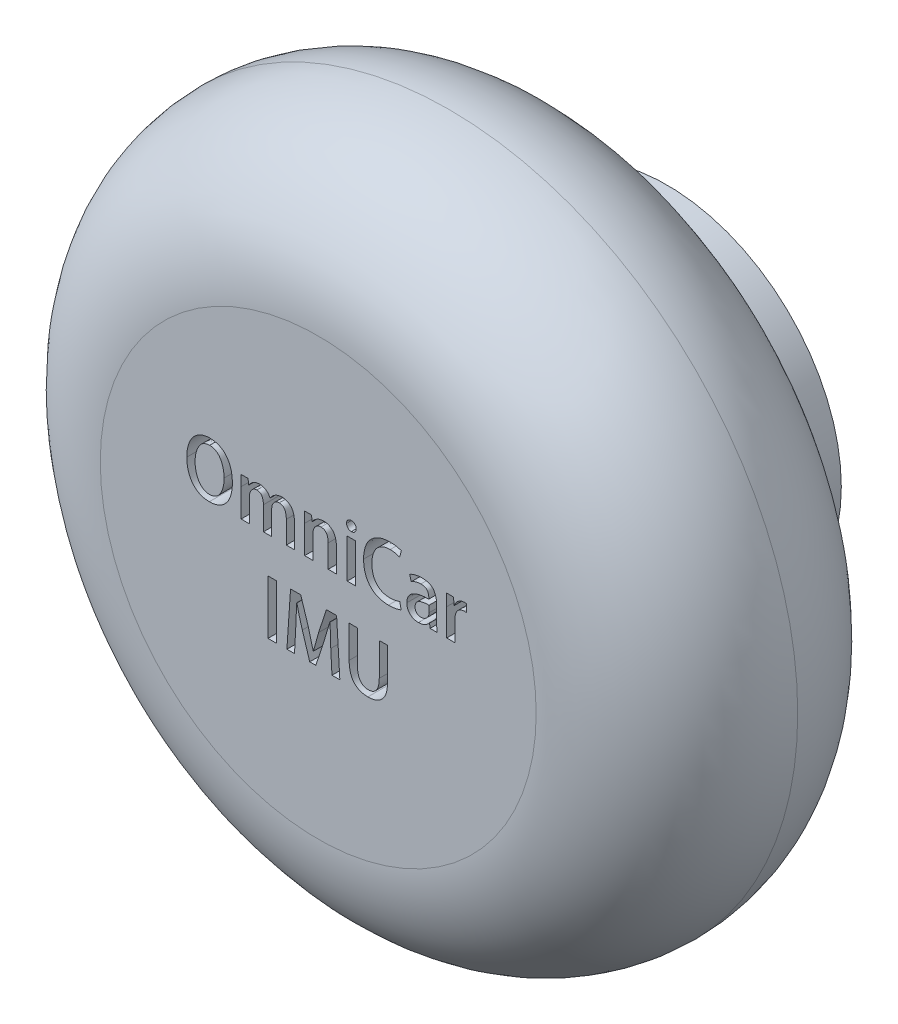
from build123d import *

# Parameters (mm, degrees)
SKETCH_1_R          = 400
EXTRUDE_1_DEPTH     = 300
FILLET_1_R          = 150
SKETCH_2_W          = 9.526879765
SKETCH_2_H          = 44.765538385
SKETCH_2_H_2        = 62.088888889
CUT_EXTRUDE_1_DEPTH = 100
SKETCH_3_R          = 200
EXTRUDE_2_DEPTH     = 100


with BuildPart() as part:
    # 草图1 → 凸台-拉伸1 (new body)
    with BuildSketch(Plane.XY):
        Circle(SKETCH_1_R)
    extrude(amount=EXTRUDE_1_DEPTH)

    # 圆角1
    fillet_1_edges = [part.edges().sort_by_distance(p)[0] for p in [
        (-400, 0, 0),
        (-400, 0, 300),
    ]]
    fillet(fillet_1_edges, radius=FILLET_1_R - 0.0001)  # a hair under: the kernel refuses the full size

    # 草图2 → 切除-拉伸1 (cut)
    # profile 1 of 11: a face of its own
    with BuildSketch(Plane.XY.offset(300)):
        with BuildLine():
            add(Edge.make_bspline(
                [(-124.135271202, 86.407969212), (-125.131940367, 86.369114214), (-127.078244568, 86.293237836), (-129.913756761, 85.848266434), (-132.589069085, 85.160822731), (-135.10879045, 84.210171328), (-137.458937755, 82.976952123), (-139.653479211, 81.492241707), (-141.687092971, 79.742227084), (-143.53381844, 77.730284885), (-145.205118624, 75.496446141), (-146.66353491, 73.046313342), (-147.890900987, 70.392084577), (-148.922682207, 67.544948436), (-149.706411494, 64.489774567), (-150.294088927, 61.239841905), (-150.65865484, 57.788434899), (-150.726577139, 55.419164729), (-150.76147075, 54.202003449)],
                knots=[0, 0, 0, 0, 1.017398794, 1.986785202, 2.923065462, 3.832757107, 4.72909869, 5.625929049, 6.53174102, 7.461145409, 8.40803719, 9.374715613, 10.365893456, 11.388720988, 12.4615384, 13.581250007, 14.757419533, 16, 16, 16, 16], degree=3))
            add(Edge.make_bspline(
                [(-150.76147075, 54.202003449), (-150.736323814, 53.031570469), (-150.687258416, 50.74788242), (-150.3169957, 47.426307436), (-149.795693414, 44.28387262), (-149.025296808, 41.336233438), (-148.074378789, 38.559832015), (-146.877069044, 35.987822784), (-145.50866399, 33.581582065), (-143.909722879, 31.394254), (-142.138603918, 29.41037415), (-140.186113215, 27.675379622), (-138.056030745, 26.209673482), (-135.758186491, 25.005117996), (-133.294266018, 24.052702907), (-130.662498083, 23.360292583), (-127.864899388, 22.936500047), (-125.944579883, 22.857666195), (-124.961491185, 22.817307979)],
                knots=[0, 0, 0, 0, 1.22750573, 2.395045433, 3.502533319, 4.566253198, 5.587370864, 6.576785445, 7.538036659, 8.486659168, 9.413382605, 10.323058447, 11.219792233, 12.119000186, 13.038585654, 13.984943243, 14.968411497, 16, 16, 16, 16], degree=3))
            add(Edge.make_bspline(
                [(-124.961491185, 22.817307979), (-124.009787453, 22.836894305), (-122.141634373, 22.875341411), (-119.411186782, 23.264653362), (-116.812166709, 23.876660582), (-114.362477195, 24.767962603), (-112.036351544, 25.883334311), (-109.86101678, 27.278662547), (-107.822255402, 28.924953361), (-105.911123334, 30.798502394), (-104.193828706, 32.9478818), (-102.679293981, 35.355484243), (-101.424258525, 38.039119168), (-100.361074655, 40.966514242), (-99.536971904, 44.157729177), (-98.934808307, 47.60624535), (-98.543870519, 51.311104882), (-98.471443142, 53.868587574), (-98.43409064, 55.18754155)],
                knots=[0, 0, 0, 0, 0.964919428, 1.894094917, 2.791917438, 3.669166524, 4.533326732, 5.403911337, 6.284393302, 7.187765246, 8.113478337, 9.068979773, 10.066339515, 11.113068972, 12.22455083, 13.40519489, 14.661797975, 16, 16, 16, 16], degree=3))
            add(Edge.make_bspline(
                [(-98.43409064, 55.18754155), (-98.453541788, 56.310705641), (-98.491576382, 58.506930252), (-98.81261086, 61.718863077), (-99.342209537, 64.763687204), (-100.052074772, 67.654612939), (-100.974519344, 70.382562479), (-102.122197596, 72.942972748), (-103.460511812, 75.345012204), (-104.992999837, 77.577547279), (-106.720197214, 79.604878833), (-108.665945962, 81.360384671), (-110.776049456, 82.885243508), (-113.095093893, 84.113650968), (-115.593529674, 85.096668651), (-118.278383087, 85.806801532), (-121.149785537, 86.255381308), (-123.12567671, 86.348457543), (-124.140209434, 86.396248073)],
                knots=[0, 0, 0, 0, 1.183096314, 2.313415522, 3.396550671, 4.436833047, 5.446633386, 6.42599101, 7.388863574, 8.339751712, 9.274678886, 10.187639936, 11.094331523, 12.010485338, 12.944704076, 13.917164331, 14.930556008, 16, 16, 16, 16], degree=3))
            Line((-124.140209434, 86.396248073), (-124.135271202, 86.407969212))
        make_face()
        with BuildLine():
            add(Edge.make_bspline(
                [(-124.463921394, 79.133747964), (-123.786721667, 79.079702319), (-122.46188383, 78.97397027), (-120.548744921, 78.542012603), (-118.766491147, 77.914349529), (-117.122370263, 77.05813819), (-115.622956379, 75.977936427), (-114.252847171, 74.689635464), (-113.024885678, 73.185299845), (-111.96244488, 71.481060632), (-111.023411283, 69.64973825), (-110.203386672, 67.730270974), (-109.4930598, 65.750932306), (-108.93707196, 63.696610451), (-108.481230525, 61.583679242), (-108.189412698, 59.398086649), (-107.989630543, 57.150619792), (-107.970604155, 55.629926737), (-107.960958947, 54.85902885)],
                knots=[0, 0, 0, 0, 0.9982897, 1.953001328, 2.875573597, 3.771039444, 4.669862355, 5.585593193, 6.529935263, 7.517851827, 8.534187404, 9.55473136, 10.586435127, 11.624837768, 12.683192089, 13.763643614, 14.866304802, 16, 16, 16, 16], degree=3))
            add(Edge.make_bspline(
                [(-107.960958947, 54.85902885), (-107.976227754, 54.013998046), (-108.006167155, 52.357043715), (-108.189397205, 49.922891926), (-108.522163337, 47.592692083), (-108.970816871, 45.359338777), (-109.576726426, 43.234582537), (-110.287232541, 41.202279603), (-111.14712359, 39.277924649), (-112.124659565, 37.463305561), (-113.220920665, 35.793456014), (-114.481232461, 34.342463905), (-115.84269875, 33.074010801), (-117.364752543, 32.056576449), (-118.992860191, 31.216666775), (-120.763669352, 30.628749451), (-122.651471981, 30.212198381), (-123.961942362, 30.132386195), (-124.632978484, 30.091517771)],
                knots=[0, 0, 0, 0, 1.218843967, 2.389935115, 3.517889963, 4.611952234, 5.672658864, 6.702052769, 7.71461876, 8.709049098, 9.672737166, 10.588621776, 11.474971284, 12.347956383, 13.220777461, 14.109099067, 15.031750089, 16, 16, 16, 16], degree=3))
            add(Edge.make_bspline(
                [(-124.632978484, 30.091517771), (-125.292062804, 30.137872615), (-126.582333436, 30.228620177), (-128.450337086, 30.637476176), (-130.199354063, 31.245112637), (-131.823340315, 32.072660682), (-133.311450929, 33.12001931), (-134.688603467, 34.363835539), (-135.934374105, 35.829483575), (-137.036893002, 37.497420712), (-138.008685082, 39.30769027), (-138.867065542, 41.213083582), (-139.601642844, 43.202365512), (-140.179441964, 45.289085215), (-140.65432982, 47.453593132), (-140.97684873, 49.708507922), (-141.181998942, 52.047212335), (-141.209082832, 53.638397463), (-141.222869847, 54.448387975)],
                knots=[0, 0, 0, 0, 0.967010063, 1.893088107, 2.791962814, 3.673520946, 4.554166096, 5.450718291, 6.385477514, 7.364450278, 8.374652903, 9.39281969, 10.424314421, 11.47822941, 12.562790703, 13.668934438, 14.813374414, 16, 16, 16, 16], degree=3))
            add(Edge.make_bspline(
                [(-141.222869847, 54.448387975), (-141.218272094, 55.238853022), (-141.209221874, 56.794805048), (-141.005502517, 59.09294443), (-140.713853577, 61.325058557), (-140.261528974, 63.482159267), (-139.697400161, 65.571298907), (-139.013611413, 67.592078771), (-138.164097601, 69.530523605), (-137.239774913, 71.400387771), (-136.156760626, 73.124860933), (-134.922738628, 74.657212968), (-133.527750575, 75.954504349), (-131.994854487, 77.040421234), (-130.313754857, 77.899016723), (-128.492650342, 78.546444633), (-126.528659833, 78.976871909), (-125.167020255, 79.072828345), (-124.468722134, 79.122038282)],
                knots=[0, 0, 0, 0, 1.141116802, 2.246175219, 3.329293398, 4.390453597, 5.426254782, 6.453272328, 7.467805296, 8.480686173, 9.46314353, 10.402578637, 11.313709221, 12.205339987, 13.1071272, 14.030724005, 14.990083905, 16, 16, 16, 16], degree=3))
            Line((-124.468722134, 79.122038282), (-124.463921394, 79.133747964))
        make_face(mode=Mode.SUBTRACT)
    # profile 2 of 11: a face of its own
    with BuildSketch(Plane.XY.offset(300)):
        with BuildLine():
            add(Edge.make_bspline(
                [(-27.088183162, 50.915272381), (-27.125249585, 51.737825915), (-27.196699368, 53.323392223), (-27.458904339, 55.603856442), (-27.818116358, 57.699078839), (-28.337500383, 59.593529601), (-28.966194229, 61.299751022), (-29.726221731, 62.812739508), (-30.622481394, 64.134334952), (-31.653779342, 65.251217125), (-32.760303243, 66.193928153), (-33.896354771, 67.01159087), (-35.053917035, 67.70731383), (-36.24748633, 68.267739119), (-37.478962879, 68.674139854), (-38.733510534, 68.974051429), (-40.021311916, 69.129110843), (-40.885353349, 69.126951753), (-41.319811183, 69.125866118)],
                knots=[0, 0, 0, 0, 1.514554981, 2.919478492, 4.220855797, 5.421856901, 6.528506598, 7.561516998, 8.529526293, 9.456466621, 10.349349076, 11.200062365, 12.029355312, 12.830963464, 13.620564142, 14.411246084, 15.201141798, 16, 16, 16, 16], degree=3))
            add(Edge.make_bspline(
                [(-41.319811183, 69.125866118), (-42.088223767, 69.099045661), (-43.577303413, 69.047071245), (-45.720952639, 68.640307365), (-47.695538398, 67.98498516), (-49.487926245, 67.056941138), (-51.123274591, 65.913685921), (-52.613230806, 64.584743099), (-53.970087193, 63.069935677), (-54.73860138, 61.943137078), (-55.129077189, 61.370619873)],
                knots=[0, 0, 0, 0, 1.111678085, 2.15428175, 3.146079518, 4.113271528, 5.064963948, 6.027339153, 6.997707066, 8, 8, 8, 8], degree=3))
            Line((-55.129077189, 61.370619873), (-55.291351372, 61.376784069))
            add(Edge.make_bspline(
                [(-55.291351372, 61.376784069), (-55.556975993, 61.954652002), (-56.078951657, 63.09021315), (-57.140259179, 64.62319517), (-58.412385345, 65.945641409), (-59.860434717, 67.081532396), (-61.48239211, 67.987657424), (-63.257106444, 68.633701464), (-65.161321085, 69.04575996), (-66.480169036, 69.098751667), (-67.154988538, 69.125866118)],
                knots=[0, 0, 0, 0, 1.011895746, 1.988463847, 2.953654145, 3.92589879, 4.910603532, 5.900283697, 6.925630881, 8, 8, 8, 8], degree=3))
            add(Edge.make_bspline(
                [(-67.154988538, 69.125866118), (-67.927942182, 69.088887629), (-69.408340556, 69.01806463), (-71.51086295, 68.570203399), (-73.403200456, 67.907026523), (-75.042404655, 66.943531125), (-76.463063543, 65.834673874), (-77.724396202, 64.65554564), (-78.804270217, 63.391957809), (-79.379339027, 62.469313652), (-79.66193634, 62.015912677)],
                knots=[0, 0, 0, 0, 1.229582084, 2.354955346, 3.408275541, 4.406389024, 5.364891722, 6.271818773, 7.150746202, 8, 8, 8, 8], degree=3))
            Line((-79.66193634, 62.015912677), (-79.902179584, 62.016508473))
            Line((-79.902179584, 62.016508473), (-80.403610591, 68.218778298))
            Line((-80.403610591, 68.218778298), (-88.750585296, 68.218778298))
            add(Edge.make_bspline(
                [(-88.750585296, 68.218778298), (-88.711840237, 67.31271925), (-88.632465522, 65.456529547), (-88.547798206, 63.09938635), (-88.476895199, 61.112855511), (-88.464095954, 59.505092463), (-88.430772377, 57.796199397), (-88.435494541, 56.622848516), (-88.437918475, 56.020555897)],
                knots=[0, 0, 0, 0, 1.337625601, 2.740314632, 3.479033829, 4.269392644, 5.111662119, 6, 6, 6, 6], degree=3))
            Line((-88.437918475, 56.020555897), (-88.426197336, 23.909974768))
            Line((-88.426197336, 23.909974768), (-78.899317572, 23.909974768))
            Line((-78.899317572, 23.909974768), (-78.899317572, 50.996369371))
            add(Edge.make_bspline(
                [(-78.899317572, 50.996369371), (-78.877576913, 51.424005948), (-78.835214233, 52.257275614), (-78.679767286, 53.465037412), (-78.464973212, 54.602511476), (-78.146922866, 55.653301284), (-77.756532206, 56.626381434), (-77.298420816, 57.525038556), (-76.76380326, 58.350436537), (-76.135242322, 59.07439642), (-75.468621593, 59.71425366), (-74.787028235, 60.280046514), (-74.094488456, 60.769758591), (-73.371543587, 61.158165245), (-72.631895852, 61.463025301), (-71.878582576, 61.69068322), (-71.105641327, 61.822210613), (-70.585298199, 61.841782486), (-70.322789576, 61.851656327)],
                knots=[0, 0, 0, 0, 1.338938243, 2.608983147, 3.806177695, 4.955669144, 6.037000754, 7.082014876, 8.106710253, 9.104545288, 10.073541867, 10.994553058, 11.873492566, 12.721935281, 13.555698717, 14.372415168, 15.178897482, 16, 16, 16, 16], degree=3))
            add(Edge.make_bspline(
                [(-70.322789576, 61.851656327), (-70.009207784, 61.835450403), (-69.40124421, 61.804030813), (-68.525645331, 61.63869977), (-67.720753503, 61.375589477), (-66.968697828, 61.037901663), (-66.28608757, 60.588059145), (-65.67397034, 60.043308638), (-65.123077309, 59.410164432), (-64.483647795, 58.426278323), (-63.840047483, 57.017640235), (-63.267880813, 55.145953568), (-62.964718108, 53.050311803), (-62.927303632, 51.586516313), (-62.907788627, 50.823015675)],
                knots=[0, 0, 0, 0, 0.755767742, 1.46526128, 2.138556882, 2.791917377, 3.445142024, 4.099181335, 4.760306138, 5.460545427, 6.918646017, 8.474278403, 10.161019963, 12, 12, 12, 12], degree=3))
            Line((-62.907788627, 50.823015675), (-62.896067489, 23.909974768))
            Line((-62.896067489, 23.909974768), (-53.369199181, 23.909974768))
            Line((-53.369199181, 23.909974768), (-53.369199181, 51.48295131))
            add(Edge.make_bspline(
                [(-53.369199181, 51.48295131), (-53.357601877, 51.881543189), (-53.335089098, 52.655292915), (-53.170249015, 53.778108084), (-52.956824977, 54.836379747), (-52.647811228, 55.824212585), (-52.272663239, 56.74961593), (-51.817642561, 57.603760671), (-51.282012009, 58.39005548), (-50.676428639, 59.098474542), (-50.014662714, 59.732156284), (-49.330711517, 60.293505299), (-48.619004897, 60.768430346), (-47.885520206, 61.160530495), (-47.12685633, 61.467192788), (-46.337496611, 61.674706223), (-45.533613333, 61.825850926), (-44.98499456, 61.843051316), (-44.710531553, 61.851656327)],
                knots=[0, 0, 0, 0, 1.273878303, 2.472862693, 3.623059418, 4.722589718, 5.776818791, 6.811738278, 7.810600646, 8.812900911, 9.785672188, 10.736743235, 11.638445065, 12.516692392, 13.392086523, 14.247515989, 15.123267277, 16, 16, 16, 16], degree=3))
            add(Edge.make_bspline(
                [(-44.710531553, 61.851656327), (-44.369821915, 61.834783914), (-43.707959434, 61.80200757), (-42.746141164, 61.644664243), (-41.866916843, 61.351120312), (-41.0404228, 60.999867044), (-40.311161978, 60.499871181), (-39.631916132, 59.93019101), (-39.04356349, 59.232268977), (-38.518590421, 58.448202892), (-38.061753965, 57.577509544), (-37.677875616, 56.626925351), (-37.334817097, 55.610725423), (-37.065829222, 54.515559153), (-36.875217865, 53.3492353), (-36.71572131, 52.117438796), (-36.637831199, 50.808401277), (-36.630530951, 49.911861905), (-36.626772608, 49.450301892)],
                knots=[0, 0, 0, 0, 0.980012396, 1.903771899, 2.788709861, 3.638782204, 4.474093012, 5.318800189, 6.1793558, 7.086352771, 8.026374509, 8.99888406, 10.029459902, 11.106063896, 12.234891297, 13.423871466, 14.673747123, 16, 16, 16, 16], degree=3))
            Line((-36.626772608, 49.450301892), (-36.615062926, 23.909974768))
            Line((-36.615062926, 23.909974768), (-27.088183162, 23.909974768))
            Line((-27.088183162, 23.909974768), (-27.088183162, 50.915272381))
        make_face()
    # profile 3 of 11: a face of its own
    with BuildSketch(Plane.XY.offset(300)):
        with BuildLine():
            add(Edge.make_bspline(
                [(20.968531846, 51.250361751), (20.931844898, 52.055080738), (20.860884343, 53.611582718), (20.592258363, 55.848928717), (20.197391902, 57.901207998), (19.676961041, 59.767237975), (19.007959835, 61.443350756), (18.209415555, 62.934339095), (17.281490733, 64.246761094), (16.202492337, 65.343227714), (15.056742122, 66.280298355), (13.883212374, 67.092928118), (12.679759433, 67.779794442), (11.447944858, 68.336580045), (10.181983121, 68.742990031), (8.900657808, 69.044709366), (7.585579795, 69.19983515), (6.702051391, 69.197460766), (6.255867371, 69.196261696)],
                knots=[0, 0, 0, 0, 1.476091517, 2.85508284, 4.12591442, 5.303507886, 6.400315668, 7.42662652, 8.397390148, 9.335202214, 10.23647071, 11.107353845, 11.948434065, 12.773042087, 13.580014786, 14.381621236, 15.182714739, 16, 16, 16, 16], degree=3))
            add(Edge.make_bspline(
                [(6.255867371, 69.196261696), (5.467154604, 69.160082977), (3.947075814, 69.090356066), (1.772962023, 68.623274398), (-0.21734821, 67.949403873), (-1.981639722, 66.979518017), (-3.525860292, 65.859902735), (-4.870458489, 64.648699883), (-6.020178046, 63.368948007), (-6.600881611, 62.412756947), (-6.884640639, 61.945517098)],
                knots=[0, 0, 0, 0, 1.204446248, 2.321318067, 3.385336789, 4.404023564, 5.384194655, 6.293849258, 7.166294637, 8, 8, 8, 8], degree=3))
            Line((-6.884640639, 61.945517098), (-7.131025164, 61.947441977))
            Line((-7.131025164, 61.947441977), (-7.623794215, 68.280775446))
            Line((-7.623794215, 68.280775446), (-15.914626612, 68.280775446))
            add(Edge.make_bspline(
                [(-15.914626612, 68.280775446), (-15.875931369, 67.361870019), (-15.796896032, 65.484998554), (-15.711830939, 63.103296268), (-15.641092202, 61.105028177), (-15.628192222, 59.497270727), (-15.594815381, 57.796199837), (-15.599536152, 56.630670273), (-15.601959792, 56.032288494)],
                knots=[0, 0, 0, 0, 1.350995368, 2.759418525, 3.500852762, 4.287973008, 5.121046957, 6, 6, 6, 6], degree=3))
            Line((-15.601959792, 56.032288494), (-15.590238653, 23.92067618))
            Line((-15.590238653, 23.92067618), (-6.063358888, 23.92067618))
            Line((-6.063358888, 23.92067618), (-6.063358888, 50.844876802))
            add(Edge.make_bspline(
                [(-6.063358888, 50.844876802), (-6.042678913, 51.276193818), (-6.002334769, 52.117641413), (-5.831806711, 53.33638215), (-5.605027971, 54.485349473), (-5.278012766, 55.550561113), (-4.861914672, 56.535350483), (-4.374912023, 57.441130291), (-3.790600997, 58.260447017), (-3.134292275, 58.992061921), (-2.434584987, 59.652519711), (-1.690972543, 60.209383839), (-0.938714803, 60.704596262), (-0.149617672, 61.085096616), (0.653770452, 61.395685817), (1.478331114, 61.621629333), (2.329138386, 61.751628564), (2.903826906, 61.771326489), (3.193659701, 61.781260748)],
                knots=[0, 0, 0, 0, 1.297863114, 2.531974758, 3.696727431, 4.816436646, 5.875785132, 6.90728509, 7.902549574, 8.893845656, 9.859056934, 10.790505744, 11.684371978, 12.562707816, 13.418876391, 14.271889095, 15.128461428, 16, 16, 16, 16], degree=3))
            add(Edge.make_bspline(
                [(3.193659701, 61.781260748), (3.562139243, 61.762288144), (4.276420258, 61.725510606), (5.299416807, 61.534577973), (6.239515893, 61.250412354), (7.10135471, 60.880687328), (7.875721331, 60.396052659), (8.547263499, 59.794389404), (9.157802701, 59.115112907), (9.82309547, 58.041175977), (10.501413584, 56.543688782), (11.073171275, 54.568610564), (11.406057719, 52.398789046), (11.421776926, 50.890711064), (11.4299424, 50.107327293)],
                knots=[0, 0, 0, 0, 0.820302985, 1.590120431, 2.308645992, 3.002287388, 3.671081278, 4.330925974, 5.003052136, 5.695874173, 7.13274083, 8.647331275, 10.258428079, 12, 12, 12, 12], degree=3))
            Line((11.4299424, 50.107327293), (11.441663539, 23.92067618))
            Line((11.441663539, 23.92067618), (20.968531846, 23.92067618))
            Line((20.968531846, 23.92067618), (20.968531846, 51.250361751))
        make_face()
    # profile 4 of 11: a face of its own
    with BuildSketch(Plane.XY.offset(300)):
        with BuildLine():
            add(Edge.make_bspline(
                [(43.555212189, 80.101847576), (43.534080392, 80.489062327), (43.492992292, 81.241952329), (43.19119712, 82.311092005), (42.717285276, 83.269598332), (42.066906443, 84.097361147), (41.258511363, 84.777171409), (40.30709591, 85.275338011), (39.221911917, 85.571881338), (38.459801075, 85.620200158), (38.062936313, 85.645361901)],
                knots=[0, 0, 0, 0, 1.062447449, 2.065794394, 3.026551065, 3.982793584, 4.93589374, 5.906448208, 6.909795153, 8, 8, 8, 8], degree=3))
            add(Edge.make_bspline(
                [(38.062936313, 85.645361901), (37.662314881, 85.619939615), (36.892802357, 85.571108559), (35.797764818, 85.278850215), (34.841109775, 84.77062616), (34.013293615, 84.099038113), (33.338845217, 83.273742938), (32.85008885, 82.313802729), (32.553295862, 81.239190418), (32.503767266, 80.48490455), (32.478220408, 80.095843787)],
                knots=[0, 0, 0, 0, 1.092393363, 2.09826611, 3.061325775, 4.023500303, 4.98567483, 5.943826475, 6.939425389, 8, 8, 8, 8], degree=3))
            add(Edge.make_bspline(
                [(32.478220408, 80.095843787), (32.498180631, 79.721992613), (32.53687422, 78.99726906), (32.848104741, 77.964290105), (33.31739248, 77.025309312), (33.968797436, 76.195827976), (34.778180757, 75.514103402), (35.7322964, 75.00720035), (36.817236224, 74.702997925), (37.583892611, 74.646151792), (37.980808137, 74.61672125)],
                knots=[0, 0, 0, 0, 1.033853352, 2.004160824, 2.963519139, 3.928002529, 4.904580227, 5.873919448, 6.899279526, 8, 8, 8, 8], degree=3))
            add(Edge.make_bspline(
                [(37.980808137, 74.61672125), (38.393372173, 74.645669732), (39.18329656, 74.701096549), (40.295704388, 75.005222918), (41.263523197, 75.510706056), (42.075045791, 76.196057248), (42.72535922, 77.025524828), (43.199025142, 77.962240357), (43.491298729, 78.999454004), (43.532504022, 79.722371256), (43.553791445, 80.095843787)],
                knots=[0, 0, 0, 0, 1.133812569, 2.170878024, 3.141238829, 4.109279117, 5.065330829, 6.01630227, 6.97518477, 8, 8, 8, 8], degree=3))
            Line((43.553791445, 80.095843787), (43.555212189, 80.101847576))
        make_face()
    # profile 5 of 11: a face of its own
    with BuildSketch(Plane.XY.offset(300)):
        with Locations((37.980802409, 45.433514593)):
            Rectangle(SKETCH_2_W, SKETCH_2_H)
    # profile 6 of 11: a face of its own
    with BuildSketch(Plane.XY.offset(300)):
        with BuildLine():
            add(Edge.make_bspline(
                [(93.468610583, 33.041612691), (93.105661611, 32.877981125), (92.356891158, 32.540406174), (91.148708517, 32.123897619), (89.837608123, 31.747402515), (87.925752899, 31.329356644), (85.395103274, 30.940806663), (83.32508642, 30.875597953), (82.271359688, 30.842403943)],
                knots=[0, 0, 0, 0, 0.623279357, 1.285836859, 1.999327964, 2.758722695, 4.350051821, 6, 6, 6, 6], degree=3))
            add(Edge.make_bspline(
                [(82.271359688, 30.842403943), (81.484368835, 30.863617671), (79.947795191, 30.905036776), (77.707281295, 31.200619436), (75.600276631, 31.690968917), (73.625403466, 32.37401531), (71.782591117, 33.245294262), (70.071217925, 34.308784401), (68.484991319, 35.556603745), (67.055192563, 37.012138596), (65.758322824, 38.629108403), (64.639398159, 40.431874708), (63.687406133, 42.397712068), (62.914771072, 44.538585735), (62.308026706, 46.844115454), (61.868685744, 49.316060111), (61.579119885, 51.95435248), (61.537717012, 53.771014497), (61.516396591, 54.706505096)],
                knots=[0, 0, 0, 0, 1.05357022, 2.05706105, 3.019831997, 3.945549259, 4.849673394, 5.743319306, 6.637992512, 7.545159443, 8.469260999, 9.40786221, 10.379774602, 11.388606811, 12.450446757, 13.567948197, 14.747614263, 16, 16, 16, 16], degree=3))
            add(Edge.make_bspline(
                [(61.516396591, 54.706505096), (61.545660695, 55.688988002), (61.602464212, 57.596050739), (61.911306439, 60.356481986), (62.3826736, 62.933518618), (63.055879426, 65.312499591), (63.871076133, 67.520554185), (64.880192733, 69.532738999), (66.07149166, 71.357135303), (67.439463705, 72.979144843), (68.941119759, 74.406894826), (70.549560402, 75.655339371), (72.271352681, 76.701884247), (74.100149384, 77.563251694), (76.035693202, 78.233145725), (78.074959249, 78.715166707), (80.221804959, 78.999770291), (81.687779354, 79.034119938), (82.435616039, 79.051642704)],
                knots=[0, 0, 0, 0, 1.300058967, 2.523498372, 3.671327638, 4.762385131, 5.790754738, 6.781204902, 7.734179646, 8.667035103, 9.582038544, 10.471113154, 11.35590086, 12.242457161, 13.14087904, 14.060872889, 15.010794189, 16, 16, 16, 16], degree=3))
            add(Edge.make_bspline(
                [(82.435616039, 79.051642704), (82.99905708, 79.042339777), (84.096168809, 79.02422546), (85.694257051, 78.892410416), (87.200070272, 78.687454651), (88.606173699, 78.385649757), (89.923732428, 78.0516622), (91.137237905, 77.659191335), (92.264986598, 77.258866956), (92.961969463, 76.933378286), (93.30000034, 76.775518995)],
                knots=[0, 0, 0, 0, 1.208363836, 2.352881735, 3.437133088, 4.465326887, 5.435785295, 6.351019915, 7.200258411, 8, 8, 8, 8], degree=3))
            Line((93.30000034, 76.775518995), (95.333841349, 84.185180695))
            add(Edge.make_bspline(
                [(95.333841349, 84.185180695), (95.079976377, 84.304447524), (94.499017137, 84.577384611), (93.474890949, 84.929477842), (92.198080701, 85.283685157), (90.683499321, 85.680588976), (88.902874001, 86.023100127), (86.863342493, 86.253396963), (84.569735358, 86.422667545), (82.956115143, 86.451482542), (82.107103338, 86.466643652)],
                knots=[0, 0, 0, 0, 0.497728815, 1.139031319, 1.919228026, 2.850533018, 3.918187005, 5.13515125, 6.492650013, 8, 8, 8, 8], degree=3))
            add(Edge.make_bspline(
                [(82.107103338, 86.466643652), (81.034305711, 86.443003459), (78.932302883, 86.396683678), (75.853417524, 85.99925226), (72.926935358, 85.358961671), (70.146869194, 84.463697121), (67.518248401, 83.312223171), (65.044286677, 81.895001638), (62.71830401, 80.231605812), (60.557569594, 78.318716654), (58.587986589, 76.15785495), (56.866153753, 73.735943526), (55.409107747, 71.06732349), (54.211007929, 68.157879863), (53.265803952, 65.012698277), (52.564489597, 61.629320146), (52.117763566, 58.002912063), (52.025371256, 55.501690156), (51.977795687, 54.213736046)],
                knots=[0, 0, 0, 0, 1.03258902, 2.023219463, 2.983439502, 3.913466857, 4.830690834, 5.741453413, 6.65369381, 7.579319873, 8.515001589, 9.462699019, 10.433390624, 11.436184352, 12.486830696, 13.590904696, 14.759484638, 16, 16, 16, 16], degree=3))
            add(Edge.make_bspline(
                [(51.977795687, 54.213736046), (52.009065873, 52.996207203), (52.069868415, 50.628813211), (52.48304562, 47.190521378), (53.093448658, 43.962886719), (53.945375292, 40.947589293), (55.042638679, 38.152223327), (56.354122339, 35.55901848), (57.92677623, 33.193196089), (59.70995097, 31.03463979), (61.711567045, 29.125581173), (63.878928902, 27.442368391), (66.228283449, 26.03010374), (68.748070832, 24.874382743), (71.438840015, 23.970701115), (74.303056701, 23.315401289), (77.340282596, 22.913437649), (79.423016425, 22.849832131), (80.48800503, 22.817307979)],
                knots=[0, 0, 0, 0, 1.218475598, 2.369234888, 3.461691683, 4.503752951, 5.500362793, 6.463244622, 7.406714516, 8.337948286, 9.259888006, 10.169706265, 11.079364509, 11.997173012, 12.939204436, 13.91536257, 14.934038004, 16, 16, 16, 16], degree=3))
            add(Edge.make_bspline(
                [(80.48800503, 22.817307979), (81.309653206, 22.827910885), (82.896007489, 22.848381892), (85.193029652, 23.023422009), (87.324811916, 23.257833914), (89.282681779, 23.597189693), (91.040804443, 24.009877391), (92.594687137, 24.436306062), (93.92804211, 24.894864922), (94.718245069, 25.263397889), (95.083354998, 25.433676985)],
                knots=[0, 0, 0, 0, 1.319898282, 2.548324642, 3.699499855, 4.764539851, 5.738494737, 6.599877469, 7.353079316, 8, 8, 8, 8], degree=3))
            Line((95.083354998, 25.433676985), (93.468610583, 33.041612691))
        make_face()
    # profile 7 of 11: a face of its own
    with BuildSketch(Plane.XY.offset(300)):
        with BuildLine():
            add(Edge.make_bspline(
                [(135.85411616, 50.724904129), (135.853686638, 51.348322805), (135.85284102, 52.575670419), (135.724753162, 54.384751561), (135.47640961, 56.120303816), (135.131250598, 57.786871072), (134.645817579, 59.374611034), (134.047660331, 60.88827905), (133.340469083, 62.332182016), (132.515440401, 63.697666212), (131.529263592, 64.953729314), (130.353670241, 66.062627439), (128.97743384, 66.987874161), (127.417747969, 67.756851242), (125.673616826, 68.358291196), (123.744939724, 68.816437781), (121.630871916, 69.107783456), (120.156853576, 69.166069067), (119.393294816, 69.196261696)],
                knots=[0, 0, 0, 0, 1.054440533, 2.075916429, 3.064907805, 4.01865999, 4.952117007, 5.869873424, 6.769371637, 7.669186107, 8.564000418, 9.462670969, 10.39121471, 11.35875065, 12.396614736, 13.505478507, 14.707808657, 16, 16, 16, 16], degree=3))
            add(Edge.make_bspline(
                [(119.393294816, 69.196261696), (118.645876891, 69.17761388), (117.183639439, 69.141131566), (115.039689008, 68.93999706), (112.992476981, 68.615969199), (111.060018563, 68.156421198), (109.256422276, 67.616785733), (107.601319265, 67.028002137), (106.111915777, 66.363671395), (105.208672196, 65.844109784), (104.774479655, 65.59435459)],
                knots=[0, 0, 0, 0, 1.178302936, 2.305214561, 3.391722364, 4.442974574, 5.433831934, 6.358209923, 7.210785417, 8, 8, 8, 8], degree=3))
            Line((104.774479655, 65.59435459), (106.767279492, 59.267162402))
            add(Edge.make_bspline(
                [(106.767279492, 59.267162402), (107.143271001, 59.509712797), (107.907552249, 60.00274712), (109.147057288, 60.625971652), (110.458337544, 61.197719132), (111.852608104, 61.65423231), (113.291230709, 62.047850263), (114.762043392, 62.326664497), (116.256710895, 62.496447342), (117.257519536, 62.520175301), (117.762463911, 62.53214692)],
                knots=[0, 0, 0, 0, 0.922698119, 1.87557659, 2.858963743, 3.872134009, 4.899888064, 5.935029996, 6.958147496, 8, 8, 8, 8], degree=3))
            add(Edge.make_bspline(
                [(117.762463911, 62.53214692), (118.27984902, 62.499682709), (119.265389547, 62.437843287), (120.658483989, 62.184802218), (121.897091733, 61.84828717), (122.989974279, 61.428127869), (123.911662719, 60.866325707), (124.671725533, 60.202574456), (125.29241649, 59.443341683), (125.84118994, 58.293131545), (126.297772586, 56.830799668), (126.717431864, 55.132169516), (126.910324772, 53.501658923), (126.857504599, 52.450116144), (126.831760958, 51.937612337)],
                knots=[0, 0, 0, 0, 1.15393987, 2.198081251, 3.147064759, 4.010936986, 4.796833452, 5.537692691, 6.250622284, 6.963605103, 8.360344222, 9.657813412, 10.858458669, 12, 12, 12, 12], degree=3))
            add(Edge.make_bspline(
                [(126.831760958, 51.937612337), (125.881191478, 51.926468182), (124.033088132, 51.904801644), (121.333559147, 51.733605634), (118.792224646, 51.415742219), (116.405854489, 50.984883702), (114.171030412, 50.439301263), (112.097789795, 49.746593923), (110.171685232, 48.938032014), (108.409540845, 48.005793818), (106.821869155, 46.939420214), (105.439927818, 45.722679319), (104.253817844, 44.378826565), (103.278077742, 42.895351459), (102.525194175, 41.268126338), (101.973679624, 39.509899222), (101.629357073, 37.613313635), (101.567907567, 36.303426753), (101.536283039, 35.629303289)],
                knots=[0, 0, 0, 0, 1.346842074, 2.618539093, 3.830292332, 4.973726366, 6.052946172, 7.086827036, 8.067668198, 9.009703997, 9.90728897, 10.771070174, 11.61139005, 12.439804247, 13.277727203, 14.143496889, 15.044564592, 16, 16, 16, 16], degree=3))
            add(Edge.make_bspline(
                [(101.536283039, 35.629303289), (101.55316304, 35.19086097), (101.586283634, 34.330584348), (101.747928612, 33.064163165), (102.033719921, 31.851823944), (102.41818769, 30.687402205), (102.916873422, 29.577023972), (103.514037786, 28.517592887), (104.22700093, 27.516081817), (105.030458981, 26.564599583), (105.94083516, 25.700133189), (106.950690835, 24.937284937), (108.057624716, 24.29756948), (109.248972692, 23.749643351), (110.53830084, 23.332421668), (111.911603577, 23.014960451), (113.380761724, 22.815021683), (114.390688684, 22.770083914), (114.911442977, 22.746912401)],
                knots=[0, 0, 0, 0, 1.01153162, 1.984746832, 2.938546434, 3.879683942, 4.808205679, 5.741140546, 6.679465131, 7.639088284, 8.608745111, 9.568325884, 10.55052558, 11.551427709, 12.586682897, 13.669591124, 14.798358223, 16, 16, 16, 16], degree=3))
            add(Edge.make_bspline(
                [(114.911442977, 22.746912401), (115.597414232, 22.769337486), (116.938336432, 22.813173571), (118.871156251, 23.156641198), (120.685456209, 23.651223773), (122.350453827, 24.374267387), (123.867486665, 25.255308163), (125.245341555, 26.242173855), (126.457718791, 27.358240309), (127.131393855, 28.205147963), (127.465321165, 28.624943216)],
                knots=[0, 0, 0, 0, 1.144862952, 2.237954051, 3.269690894, 4.279106881, 5.259363889, 6.194794462, 7.105195575, 8, 8, 8, 8], degree=3))
            Line((127.465321165, 28.624943216), (127.69984706, 28.627246196))
            Line((127.69984706, 28.627246196), (128.321124706, 23.609361357))
            Line((128.321124706, 23.609361357), (136.502892079, 23.609361357))
            add(Edge.make_bspline(
                [(136.502892079, 23.609361357), (136.376288871, 24.368518717), (136.108936456, 25.971657814), (135.942301519, 28.513198427), (135.850961634, 31.240455276), (135.845285593, 33.11449685), (135.842395021, 34.068867963)],
                knots=[0, 0, 0, 0, 0.879539962, 1.857355241, 2.908840502, 4, 4, 4, 4], degree=3))
            Line((135.842395021, 34.068867963), (135.85411616, 50.724904129))
        make_face()
        with BuildLine():
            add(Edge.make_bspline(
                [(127.078134025, 38.577301466), (127.061538381, 38.247029297), (127.029214686, 37.603751056), (126.866161754, 36.666311038), (126.652514369, 35.77531662), (126.340942224, 34.931113588), (125.952356484, 34.135653053), (125.495951976, 33.373034665), (124.938223209, 32.673314938), (124.318253306, 32.017625258), (123.642884283, 31.418707641), (122.907906546, 30.901615377), (122.136112487, 30.453417873), (121.319618141, 30.091700747), (120.470349959, 29.791841277), (119.577141634, 29.583840173), (118.642143372, 29.453469129), (118.005353019, 29.425369305), (117.680335736, 29.411027177)],
                knots=[0, 0, 0, 0, 1.085989939, 2.115206079, 3.122266748, 4.094256462, 5.065906082, 6.029357422, 7.009136726, 8.000318945, 8.993167018, 9.970497608, 10.949517621, 11.921932287, 12.90171159, 13.905731883, 14.931087242, 16, 16, 16, 16], degree=3))
            add(Edge.make_bspline(
                [(117.680335736, 29.411027177), (117.243921553, 29.424272908), (116.388935634, 29.450222829), (115.162892201, 29.796073736), (114.036533181, 30.346008522), (113.01545274, 31.10672972), (112.160372289, 32.126524927), (111.552901071, 33.409538199), (111.162623046, 34.926681557), (111.105315062, 36.021662715), (111.074883942, 36.603108793)],
                knots=[0, 0, 0, 0, 0.948053591, 1.857346764, 2.748867809, 3.66721443, 4.610702389, 5.616513129, 6.734344346, 8, 8, 8, 8], degree=3))
            add(Edge.make_bspline(
                [(111.074883942, 36.603108793), (111.109385146, 37.070209102), (111.176145247, 37.97405189), (111.475929036, 39.259135915), (111.906532098, 40.429606774), (112.500104863, 41.466024196), (113.221181713, 42.391709881), (114.108045744, 43.168122015), (115.126906152, 43.83803956), (116.698912712, 44.520620353), (118.810356505, 45.160940798), (121.455606753, 45.723379808), (124.224148588, 46.018476309), (126.107635558, 46.014616134), (127.066412886, 46.012651136)],
                knots=[0, 0, 0, 0, 0.805457906, 1.558567412, 2.26400989, 2.945616358, 3.607166206, 4.274925363, 4.966046766, 5.698395365, 7.216983932, 8.758337924, 10.349852081, 12, 12, 12, 12], degree=3))
            Line((127.066412886, 46.012651136), (127.078134025, 38.577301466))
        make_face(mode=Mode.SUBTRACT)
    # profile 8 of 11: a face of its own
    with BuildSketch(Plane.XY.offset(300)):
        with BuildLine():
            add(Edge.make_bspline(
                [(169.935555796, 68.966765694), (169.553799272, 69.033058201), (168.774100672, 69.168453858), (167.982887342, 69.186865019), (167.579068385, 69.196261696)],
                knots=[0, 0, 0, 0, 0.97924127, 2, 2, 2, 2], degree=3))
            add(Edge.make_bspline(
                [(167.579068385, 69.196261696), (166.966115856, 69.162780535), (165.750415001, 69.096375595), (163.970763377, 68.618443738), (162.278821673, 67.840319796), (160.674373961, 66.793166613), (159.186870325, 65.49556053), (157.910480894, 63.921496909), (156.792700839, 62.13510497), (156.25318756, 60.809287907), (155.975530508, 60.12696465)],
                knots=[0, 0, 0, 0, 0.938175605, 1.860732817, 2.801619752, 3.780189859, 4.786007179, 5.811395864, 6.873648904, 8, 8, 8, 8], degree=3))
            Line((155.975530508, 60.12696465), (155.647017808, 60.129004105))
            Line((155.647017808, 60.129004105), (155.318505107, 68.243801726))
            Line((155.318505107, 68.243801726), (147.02767271, 68.243801726))
            add(Edge.make_bspline(
                [(147.02767271, 68.243801726), (147.081634337, 67.204395957), (147.191787141, 65.082638989), (147.275024338, 61.808990098), (147.340950103, 58.332154194), (147.340548298, 55.938467459), (147.34033953, 54.6947725)],
                knots=[0, 0, 0, 0, 0.921405029, 1.880880017, 2.898962507, 4, 4, 4, 4], degree=3))
            Line((147.34033953, 54.6947725), (147.352060669, 23.635358683))
            Line((147.352060669, 23.635358683), (156.878940434, 23.635358683))
            Line((156.878940434, 23.635358683), (156.878940434, 47.315679713))
            add(Edge.make_bspline(
                [(156.878940434, 47.315679713), (156.893548355, 47.796705187), (156.921990034, 48.733263643), (157.046149832, 50.102467104), (157.269906232, 51.392207483), (157.574210131, 52.608771412), (157.96282339, 53.750465783), (158.426324711, 54.824703967), (158.995791962, 55.808605831), (159.628627115, 56.721787531), (160.34280667, 57.537586462), (161.11682414, 58.265600751), (161.976452604, 58.864114332), (162.888060632, 59.375574281), (163.87488851, 59.756866444), (164.91279435, 60.059105137), (166.020834113, 60.232243951), (166.780693887, 60.263526075), (167.168427509, 60.279488404)],
                knots=[0, 0, 0, 0, 1.241840886, 2.417868999, 3.544527356, 4.616704577, 5.650820151, 6.654086497, 7.630544836, 8.5797601, 9.516878827, 10.423948895, 11.314471818, 12.213419717, 13.114913654, 14.038234368, 14.998969914, 16, 16, 16, 16], degree=3))
            add(Edge.make_bspline(
                [(167.168427509, 60.279488404), (167.658370606, 60.272265548), (168.583106096, 60.258632881), (169.496246881, 60.113210984), (169.925587672, 60.044836475)],
                knots=[0, 0, 0, 0, 1.059639438, 2, 2, 2, 2], degree=3))
            Line((169.925587672, 60.044836475), (169.935555796, 68.966765694))
        make_face()
    # profile 9 of 11: a face of its own
    with BuildSketch(Plane.XY.offset(300)):
        with Locations((-52.876424403, -48.256994623)):
            Rectangle(SKETCH_2_W, SKETCH_2_H_2)
    # profile 10 of 11: a face of its own
    with BuildSketch(Plane.XY.offset(300)):
        with BuildLine():
            Line((21.078708259, -17.201780022), (9.369485354, -17.201780022))
            Line((9.369485354, -17.201780022), (0.405873336, -44.488717237))
            add(Edge.make_bspline(
                [(0.405873336, -44.488717237), (-0.177229625, -46.376357553), (-1.318603062, -50.071249638), (-2.882990006, -55.534860138), (-4.269010074, -60.801831685), (-5.095763917, -64.258712145), (-5.500194259, -65.949744322)],
                knots=[0, 0, 0, 0, 1.06482216, 2.08429696, 3.06287894, 4, 4, 4, 4], degree=3))
            Line((-5.500194259, -65.949744322), (-5.731374531, -65.949744322))
            add(Edge.make_bspline(
                [(-5.731374531, -65.949744322), (-6.12858187, -64.242954342), (-6.936669731, -60.77062105), (-8.297474599, -55.505457185), (-9.767715683, -50.080951691), (-10.843403224, -46.428669878), (-11.389957671, -44.572953613)],
                knots=[0, 0, 0, 0, 0.950771496, 1.934271678, 2.950408035, 4, 4, 4, 4], degree=3))
            Line((-11.389957671, -44.572953613), (-20.105455063, -17.201780022))
            Line((-20.105455063, -17.201780022), (-31.733924707, -17.201780022))
            Line((-31.733924707, -17.201780022), (-35.934560876, -79.188627403))
            Line((-35.934560876, -79.188627403), (-27.211742068, -79.188627403))
            Line((-27.211742068, -79.188627403), (-25.838936624, -53.755978933))
            add(Edge.make_bspline(
                [(-25.838936624, -53.755978933), (-25.715032533, -51.528207131), (-25.465027005, -47.033155654), (-25.221720884, -41.412863595), (-25.004025059, -36.93581038), (-24.89852693, -33.685091764), (-24.780938073, -30.553058261), (-24.738860711, -28.507199158), (-24.718187224, -27.502025796)],
                knots=[0, 0, 0, 0, 1.528265809, 3.083634274, 3.853229214, 4.59840858, 5.311368824, 6, 6, 6, 6], degree=3))
            Line((-24.718187224, -27.502025796), (-24.46613118, -27.50109773))
            add(Edge.make_bspline(
                [(-24.46613118, -27.50109773), (-24.052896854, -29.420317884), (-23.214566014, -33.313850793), (-21.730570719, -39.184654237), (-20.099657149, -45.186074066), (-18.874238254, -49.202584561), (-18.253526587, -51.237068389)],
                knots=[0, 0, 0, 0, 0.959753872, 1.947058171, 2.960122984, 4, 4, 4, 4], degree=3))
            Line((-18.253526587, -51.237068389), (-9.769037602, -78.620948474))
            Line((-9.769037602, -78.620948474), (-2.743503859, -78.620948474))
            Line((-2.743503859, -78.620948474), (6.462367943, -50.666891701))
            add(Edge.make_bspline(
                [(6.462367943, -50.666891701), (7.10838199, -48.688632426), (8.387693191, -44.771056238), (10.162755757, -38.923870118), (11.812997561, -33.182859191), (12.820805686, -29.381001712), (13.318890426, -27.502025796)],
                knots=[0, 0, 0, 0, 1.033513873, 2.046682856, 3.034620343, 4, 4, 4, 4], degree=3))
            Line((13.318890426, -27.502025796), (13.568654947, -27.50109773))
            add(Edge.make_bspline(
                [(13.568654947, -27.50109773), (13.564778291, -28.498688354), (13.556873946, -30.532735061), (13.597125157, -33.634515436), (13.662355483, -36.841871445), (13.828870272, -41.229761243), (14.061901706, -46.720714603), (14.271255985, -51.10809257), (14.374824105, -53.278540169)],
                knots=[0, 0, 0, 0, 0.69615936, 1.419440619, 2.164688967, 2.934803833, 4.483639269, 6, 6, 6, 6], degree=3))
            Line((14.374824105, -53.278540169), (15.748993006, -79.188627403))
            Line((15.748993006, -79.188627403), (24.793358284, -79.188627403))
            Line((24.793358284, -79.188627403), (21.078708259, -17.201780022))
        make_face()
    # profile 11 of 11: a face of its own
    with BuildSketch(Plane.XY.offset(300)):
        with BuildLine():
            Line((79.537653261, -17.551065375), (70.010773496, -17.551065375))
            Line((70.010773496, -17.551065375), (70.010773496, -55.098971666))
            add(Edge.make_bspline(
                [(70.010773496, -55.098971666), (69.989539787, -55.841670736), (69.948571584, -57.274630226), (69.789923419, -59.346941335), (69.523425186, -61.263981744), (69.151632186, -63.029790403), (68.673922387, -64.644709748), (68.090028946, -66.10318473), (67.405695838, -67.411097672), (66.621115572, -68.567947084), (65.729241378, -69.571281316), (64.76713559, -70.449660268), (63.712457663, -71.176699402), (62.588448557, -71.78833789), (61.374806951, -72.24229617), (60.082680755, -72.557218268), (58.714213265, -72.749305007), (57.774342428, -72.768353276), (57.292661873, -72.778115448)],
                knots=[0, 0, 0, 0, 1.442558911, 2.783265207, 4.033293762, 5.19797452, 6.283894868, 7.299176403, 8.243481286, 9.144954945, 10.005756174, 10.844503658, 11.66816234, 12.486940923, 13.323278702, 14.176003432, 15.065208066, 16, 16, 16, 16], degree=3))
            add(Edge.make_bspline(
                [(57.292661873, -72.778115448), (56.846164894, -72.772932762), (55.972317013, -72.762789627), (54.695596515, -72.570684831), (53.488343323, -72.238760838), (52.342942893, -71.778021236), (51.260044856, -71.193495114), (50.249654433, -70.465010885), (49.308333239, -69.600012875), (48.425234059, -68.604627266), (47.631738749, -67.451573999), (46.945612552, -66.146261246), (46.351591011, -64.68572423), (45.885127924, -63.06655429), (45.492552019, -61.296394349), (45.219533134, -59.370531745), (45.041292472, -57.290451616), (45.012028558, -55.852277866), (44.996900807, -55.108825214)],
                knots=[0, 0, 0, 0, 0.880869997, 1.723967724, 2.54076827, 3.348096003, 4.15667844, 4.964596865, 5.80091263, 6.676282017, 7.586647838, 8.557371955, 9.582678263, 10.694376867, 11.880403812, 13.160330013, 14.532054847, 16, 16, 16, 16], degree=3))
            Line((44.996900807, -55.108825214), (44.996900807, -17.551065375))
            Line((44.996900807, -17.551065375), (35.470021042, -17.551065375))
            Line((35.470021042, -17.551065375), (35.470021042, -54.531292737))
            add(Edge.make_bspline(
                [(35.470021042, -54.531292737), (35.494254617, -55.635810977), (35.541081475, -57.770086285), (35.849831261, -60.844071705), (36.323719794, -63.676694842), (36.976451774, -66.26909703), (37.803058206, -68.626953437), (38.811764645, -70.743827519), (39.998283466, -72.618348077), (41.376435541, -74.24062591), (42.902930499, -75.636907042), (44.538928222, -76.861619323), (46.318441251, -77.870339199), (48.209879975, -78.709029069), (50.229207994, -79.344615669), (52.369764491, -79.768370663), (54.626172113, -80.040116457), (56.173335987, -80.048195658), (56.964149173, -80.052325239)],
                knots=[0, 0, 0, 0, 1.389947096, 2.68581329, 3.884176986, 5.001519278, 6.046082896, 7.023506491, 7.946473535, 8.830015835, 9.69383004, 10.545329235, 11.396344648, 12.262399475, 13.145009074, 14.054291982, 15.00547603, 16, 16, 16, 16], degree=3))
            add(Edge.make_bspline(
                [(56.964149173, -80.052325239), (57.78996715, -80.042606254), (59.402954284, -80.023623138), (61.760426983, -79.764790503), (63.989918173, -79.304061974), (66.098430597, -78.667632341), (68.077278572, -77.809300358), (69.934298951, -76.769969977), (71.657598823, -75.520969499), (73.269670357, -74.101257832), (74.72291439, -72.449172703), (75.985799194, -70.550454817), (77.05103422, -68.411463199), (77.925834067, -66.041581685), (78.618590218, -63.4411269), (79.108875706, -60.602063234), (79.44680315, -57.529689819), (79.498989794, -55.399187556), (79.525932122, -54.299276059)],
                knots=[0, 0, 0, 0, 1.013962662, 1.980471211, 2.907472823, 3.806985122, 4.680561309, 5.551651082, 6.415505808, 7.289926821, 8.185106327, 9.109702809, 10.082849364, 11.113391155, 12.207519227, 13.383461846, 14.649163417, 16, 16, 16, 16], degree=3))
            Line((79.525932122, -54.299276059), (79.537653261, -17.551065375))
        make_face()
    extrude(amount=-CUT_EXTRUDE_1_DEPTH, mode=Mode.SUBTRACT)

    # 草图3 → 凸台-拉伸2 (add)
    with BuildSketch(Plane(origin=(0, 0, 0), x_dir=(-1, 0, 0), z_dir=(0, 0, -1))):
        with Locations(Location((0, 0, 0), (0, 0, 180))):
            Circle(SKETCH_3_R)
    extrude(amount=EXTRUDE_2_DEPTH)


solid = part.part
